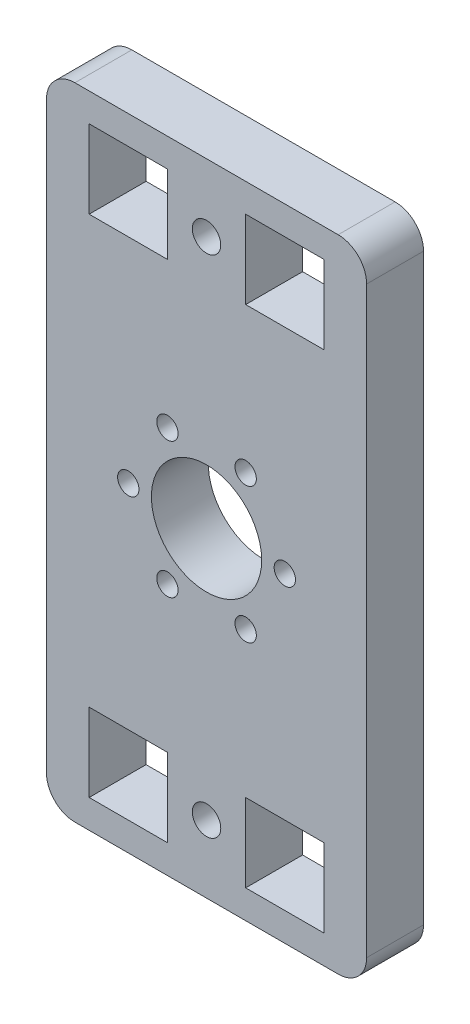
from build123d import *

# Parameters (mm, degrees)
SKETCH1_R           = 7.75
SKETCH1_R_2         = 1.5
SKETCH1_R_3         = 2
SKETCH1_W           = 11
SKETCH1_H           = 11
BOSS_EXTRUDE2_DEPTH = 8


with BuildPart() as part:
    # Sketch1 → Boss-Extrude2 (new body)
    with BuildSketch(Plane.XY):
        with BuildLine():
            Line((18.5, -45), (-18.5, -45))
            ThreePointArc((-18.5, -45), (-21.328427125, -43.828427125), (-22.5, -41))
            Line((-22.5, -41), (-22.5, 41))
            ThreePointArc((-22.5, 41), (-21.328427125, 43.828427125), (-18.5, 45))
            Line((-18.5, 45), (18.5, 45))
            ThreePointArc((18.5, 45), (21.328427125, 43.828427125), (22.5, 41))
            Line((22.5, 41), (22.5, -41))
            ThreePointArc((22.5, -41), (21.328427125, -43.828427125), (18.5, -45))
        make_face()
        Circle(SKETCH1_R, mode=Mode.SUBTRACT)
        with Locations((-11, 0)):
            Circle(SKETCH1_R_2, mode=Mode.SUBTRACT)
        with Locations((-5.5, 9.526279442)):
            Circle(SKETCH1_R_2, mode=Mode.SUBTRACT)
        with Locations((5.5, 9.526279442)):
            Circle(SKETCH1_R_2, mode=Mode.SUBTRACT)
        with Locations((11, 0)):
            Circle(SKETCH1_R_2, mode=Mode.SUBTRACT)
        with Locations((5.5, -9.526279442)):
            Circle(SKETCH1_R_2, mode=Mode.SUBTRACT)
        with Locations((-5.5, -9.526279442)):
            Circle(SKETCH1_R_2, mode=Mode.SUBTRACT)
        with Locations((0, -35.5)):
            Circle(SKETCH1_R_3, mode=Mode.SUBTRACT)
        with Locations((0, 35.5)):
            Circle(SKETCH1_R_3, mode=Mode.SUBTRACT)
        with Locations((-11, -35.5)):
            Rectangle(SKETCH1_W, SKETCH1_H, mode=Mode.SUBTRACT)
        with Locations((11, -35.5)):
            Rectangle(SKETCH1_W, SKETCH1_H, mode=Mode.SUBTRACT)
        with Locations((11, 35.5)):
            Rectangle(SKETCH1_W, SKETCH1_H, mode=Mode.SUBTRACT)
        with Locations((-11, 35.5)):
            Rectangle(SKETCH1_W, SKETCH1_H, mode=Mode.SUBTRACT)
    extrude(amount=BOSS_EXTRUDE2_DEPTH)


solid = part.part
